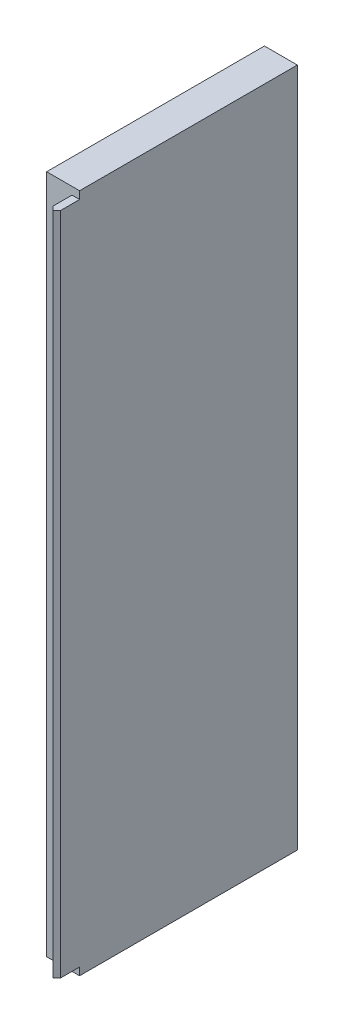
from build123d import *

# Parameters (mm, degrees)
BOSS_EXTRUDE1_DEPTH = 105
SKETCH2_W           = 5.2
SKETCH2_H           = 34.4
BOSS_EXTRUDE2_DEPTH = 1.2
SKETCH3_W           = 5.2
SKETCH3_H           = 34.4
BOSS_EXTRUDE3_DEPTH = 1.2
CUT_EXTRUDE1_REACH  = 110.369
SKETCH4_W           = 3
SKETCH4_H           = 3
CHAMFER1_SIZE       = 1


with BuildPart() as part:
    # Sketch1 → Boss-Extrude1 (new body)
    with BuildSketch(Plane(origin=(0, 0, 0), x_dir=(1, 0, 0), z_dir=(0, 1, 0))):
        Polygon((0, -16), (0, 16), (-4, 16), (-4, 17.2), (1.2, 17.2), (1.2, -17.2), (1.2, -21.2), (0, -21.2), (0, -17.2), (-4, -17.2), (-4, -16), align=None)
    extrude(amount=BOSS_EXTRUDE1_DEPTH)

    # Sketch2 → Boss-Extrude2 (add)
    with BuildSketch(Plane(origin=(0, 105, 0), x_dir=(1, 0, 0), z_dir=(0, 1, 0))):
        with Locations((-1.4, 0)):
            Rectangle(SKETCH2_W, SKETCH2_H)
    extrude(amount=BOSS_EXTRUDE2_DEPTH)

    # Sketch3 → Boss-Extrude3 (add)
    with BuildSketch(Plane.XZ):
        with Locations((-1.4, 0)):
            Rectangle(SKETCH3_W, SKETCH3_H)
    extrude(amount=BOSS_EXTRUDE3_DEPTH)

    # Sketch4 → Cut-Extrude1 (cut, up to next)
    with BuildSketch(Plane(origin=(0, 0, 0), x_dir=(1, 0, 0), z_dir=(0, 1, 0)), mode=Mode.PRIVATE) as cut_extrude1_sk1:
        with Locations((-1.5, -11)):
            Rectangle(SKETCH4_W, SKETCH4_H)
    cut_extrude1_tool1 = extrude(cut_extrude1_sk1.sketch, amount=-CUT_EXTRUDE1_REACH, mode=Mode.PRIVATE) & part.part
    # Sketch4 → Cut-Extrude1 (cut, up to next)
    with BuildSketch(Plane(origin=(0, 0, 0), x_dir=(1, 0, 0), z_dir=(0, 1, 0)), mode=Mode.PRIVATE) as cut_extrude1_sk2:
        with Locations((-1.5, -3.666666667)):
            Rectangle(SKETCH4_W, SKETCH4_H)
    cut_extrude1_tool2 = extrude(cut_extrude1_sk2.sketch, amount=-CUT_EXTRUDE1_REACH, mode=Mode.PRIVATE) & part.part
    # Sketch4 → Cut-Extrude1 (cut, up to next)
    with BuildSketch(Plane(origin=(0, 0, 0), x_dir=(1, 0, 0), z_dir=(0, 1, 0)), mode=Mode.PRIVATE) as cut_extrude1_sk3:
        with Locations((-1.5, 3.666666667)):
            Rectangle(SKETCH4_W, SKETCH4_H)
    cut_extrude1_tool3 = extrude(cut_extrude1_sk3.sketch, amount=-CUT_EXTRUDE1_REACH, mode=Mode.PRIVATE) & part.part
    # Sketch4 → Cut-Extrude1 (cut, up to next)
    with BuildSketch(Plane(origin=(0, 0, 0), x_dir=(1, 0, 0), z_dir=(0, 1, 0)), mode=Mode.PRIVATE) as cut_extrude1_sk4:
        with Locations((-1.5, 11)):
            Rectangle(SKETCH4_W, SKETCH4_H)
    cut_extrude1_tool4 = extrude(cut_extrude1_sk4.sketch, amount=-CUT_EXTRUDE1_REACH, mode=Mode.PRIVATE) & part.part
    add(cut_extrude1_tool1.solids().sort_by_distance((-1.5, 0, 11))[0], mode=Mode.SUBTRACT)
    add(cut_extrude1_tool2.solids().sort_by_distance((-1.5, 0, 3.666667))[0], mode=Mode.SUBTRACT)
    add(cut_extrude1_tool3.solids().sort_by_distance((-1.5, 0, -3.666667))[0], mode=Mode.SUBTRACT)
    add(cut_extrude1_tool4.solids().sort_by_distance((-1.5, 0, -11))[0], mode=Mode.SUBTRACT)

    # Chamfer1
    # the kernel refuses this chamfer: 1 mm, written as the material it takes off along each edge
    with BuildSketch(Plane(origin=(0, -2.571682988, 21.2), x_dir=(-0.02749587661058639, 0, -0.9996219169112968), z_dir=(0, 1, 0))) as chamfer1_piece_1:
        Polygon((CHAMFER1_SIZE * 0.999621916911, -CHAMFER1_SIZE * 0.0274958766106), (-CHAMFER1_SIZE * 0.0274958766106, -CHAMFER1_SIZE * 0.999621916911), (0, 0), align=None)
    extrude(amount=110.143365976, mode=Mode.SUBTRACT)
    with BuildSketch(Plane(origin=(1.2, -2.571682988, 21.2), x_dir=(0.027495876610586077, 0, -0.9996219169112968), z_dir=(0, 1, 0))) as chamfer1_piece_2:
        Polygon((CHAMFER1_SIZE * 0.999621916911, CHAMFER1_SIZE * 0.0274958766106), (-CHAMFER1_SIZE * 0.0274958766106, CHAMFER1_SIZE * 0.999621916911), (0, 0), align=None)
    extrude(amount=110.143365976, mode=Mode.SUBTRACT)


solid = part.part
